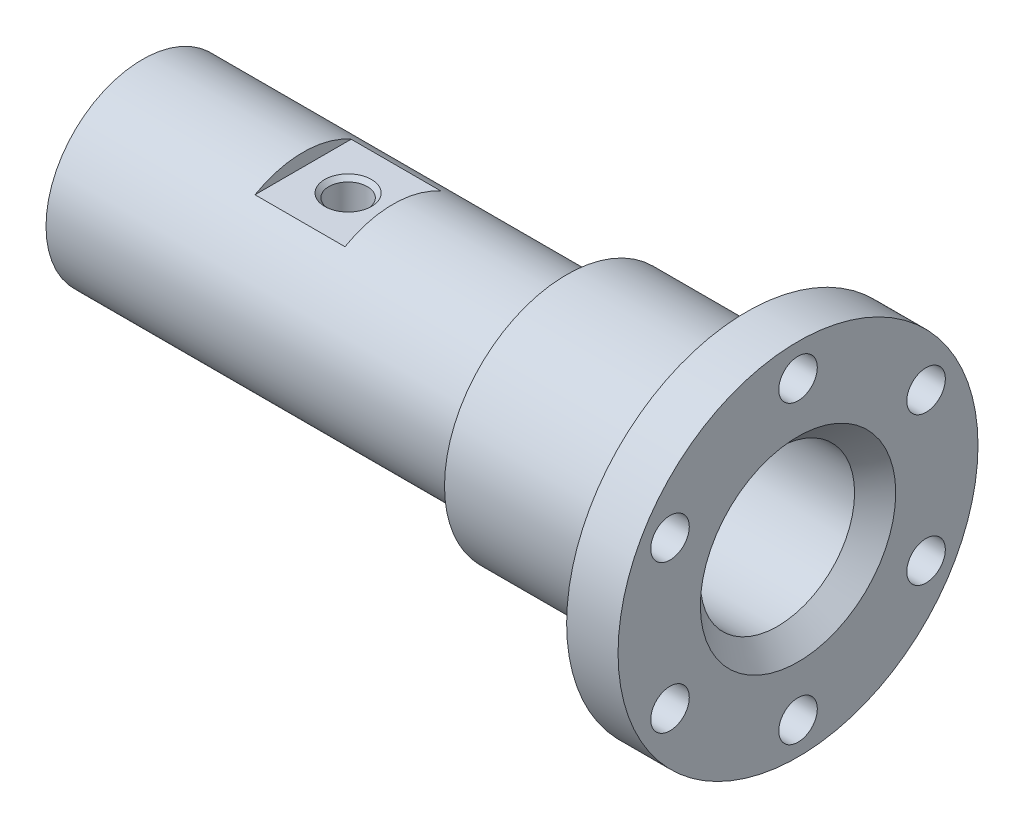
from build123d import *

# Parameters (mm, degrees)
FILLET2_R               = 2.5
CHAMFER3_SIZE           = 2
CHAMFER4_SIZE           = 8
SKETCH3_R               = 7.5
CUT_EXTRUDE1_DEPTH      = 274.541587332
CUT_EXTRUDE2_DEPTH      = 181.994025949
CUT_EXTRUDE2_DEPTH_BACK = 181.994025949
SKETCH4_W               = 35
SKETCH4_H               = 5
CUT_EXTRUDE3_DEPTH      = 181.994025949
CUT_EXTRUDE3_DEPTH_BACK = 181.994025949
SKETCH5_W               = 30
SKETCH5_H               = 6
SKETCH6_R               = 7.5
CUT_EXTRUDE4_DEPTH      = 28
CHAMFER5_SIZE           = 1.6
SKETCH7_R               = 9
CUT_EXTRUDE5_DEPTH      = 33
CHAMFER6_SIZE           = 1.6
SKETCH8_R               = 6
CUT_EXTRUDE6_DEPTH      = 60


with BuildPart() as part:
    # Sketch1 → Revolve1 (revolve)
    with BuildSketch(Plane.XY):
        Polygon((103.47826087, -30), (103.47826087, -70), (83.47826087, -70), (83.47826087, -47.5), (13.47826087, -47.5), (13.47826087, -37.5), (-151.52173913, -37.5), (-151.52173913, -22.5), (-125.02173913, -22.5), (-119.02173913, -27.5), (-106.52173913, -27.5), (-106.52173913, -17.5), (-16.52173913, -17.5), (-16.52173913, -27.5), (-1.52173913, -27.5), (-1.52173913, -22.5), (43.47826087, -22.5), (43.47826087, -30), align=None)
    revolve(axis=Axis((-977.747346799, 0, 0), (1, 0, 0)))

    # Fillet2
    fillet2_edges = [part.edges().sort_by_distance(p)[0] for p in [
        (-106.52173913, 27.5, 0),
        (-119.02173913, 27.5, 0),
    ]]
    fillet(fillet2_edges, radius=FILLET2_R)

    # Chamfer3
    chamfer3_edges = [part.edges().sort_by_distance(p)[0] for p in [
        (-151.52173913, 22.5, 0),
    ]]
    chamfer(chamfer3_edges, length=CHAMFER3_SIZE)

    # Chamfer4
    chamfer4_edges = [part.edges().sort_by_distance(p)[0] for p in [
        (103.47826087, 30, 0),
    ]]
    chamfer(chamfer4_edges, length=CHAMFER4_SIZE)

    # Sketch3 → Cut-Extrude1 (cut, through all)
    with BuildSketch(Plane(origin=(103.47826087, 0, 0), x_dir=(0, 0, -1), z_dir=(1, 0, 0))):
        with Locations((0, 57.5)):
            Circle(SKETCH3_R)
        with Locations((49.796460718, 28.75)):
            Circle(SKETCH3_R)
        with Locations((49.796460718, -28.75)):
            Circle(SKETCH3_R)
        with Locations((0, -57.5)):
            Circle(SKETCH3_R)
        with Locations((-49.796460718, -28.75)):
            Circle(SKETCH3_R)
        with Locations((-49.796460718, 28.75)):
            Circle(SKETCH3_R)
    extrude(amount=-CUT_EXTRUDE1_DEPTH, mode=Mode.SUBTRACT)

    # Sketch4 → Cut-Extrude2 (cut, two sides: drawn at the far end of the back side and taken through both)
    with BuildSketch(Plane.XY.offset(-CUT_EXTRUDE2_DEPTH_BACK)):
        with Locations((-71.52173913, 35)):
            Rectangle(SKETCH4_W, SKETCH4_H)
    extrude(amount=CUT_EXTRUDE2_DEPTH + CUT_EXTRUDE2_DEPTH_BACK, mode=Mode.SUBTRACT)

    # Sketch5 → Cut-Extrude3 (cut, two sides: drawn at the far end of the back side and taken through both)
    with BuildSketch(Plane.XY.offset(-CUT_EXTRUDE3_DEPTH_BACK)):
        with Locations((28.47826087, -44.5)):
            Rectangle(SKETCH5_W, SKETCH5_H)
    extrude(amount=CUT_EXTRUDE3_DEPTH + CUT_EXTRUDE3_DEPTH_BACK, mode=Mode.SUBTRACT)

    # Sketch6 → Cut-Extrude4 (cut)
    with BuildSketch(Plane(origin=(0, 32.5, 0), x_dir=(1, 0, 0), z_dir=(0, 1, 0))):
        with Locations((-71.52173913, 0)):
            Circle(SKETCH6_R)
    extrude(amount=-CUT_EXTRUDE4_DEPTH, mode=Mode.SUBTRACT)

    # Chamfer5
    chamfer5_edges = [part.edges().sort_by_distance(p)[0] for p in [
        (-79.02173913, 32.5, 0),
    ]]
    chamfer(chamfer5_edges, length=CHAMFER5_SIZE)

    # Sketch7 → Cut-Extrude5 (cut)
    with BuildSketch(Plane.XZ.offset(41.5)):
        with Locations((28.47826087, 0)):
            Circle(SKETCH7_R)
    extrude(amount=-CUT_EXTRUDE5_DEPTH, mode=Mode.SUBTRACT)

    # Chamfer6
    chamfer6_edges = [part.edges().sort_by_distance(p)[0] for p in [
        (19.47826087, -41.5, 0),
    ]]
    chamfer(chamfer6_edges, length=CHAMFER6_SIZE)

    # Sketch8 → Cut-Extrude6 (cut)
    with BuildSketch(Plane.XY):
        with Locations((28.47826087, 0)):
            Circle(SKETCH8_R)
    extrude(amount=-CUT_EXTRUDE6_DEPTH, mode=Mode.SUBTRACT)


solid = part.part
